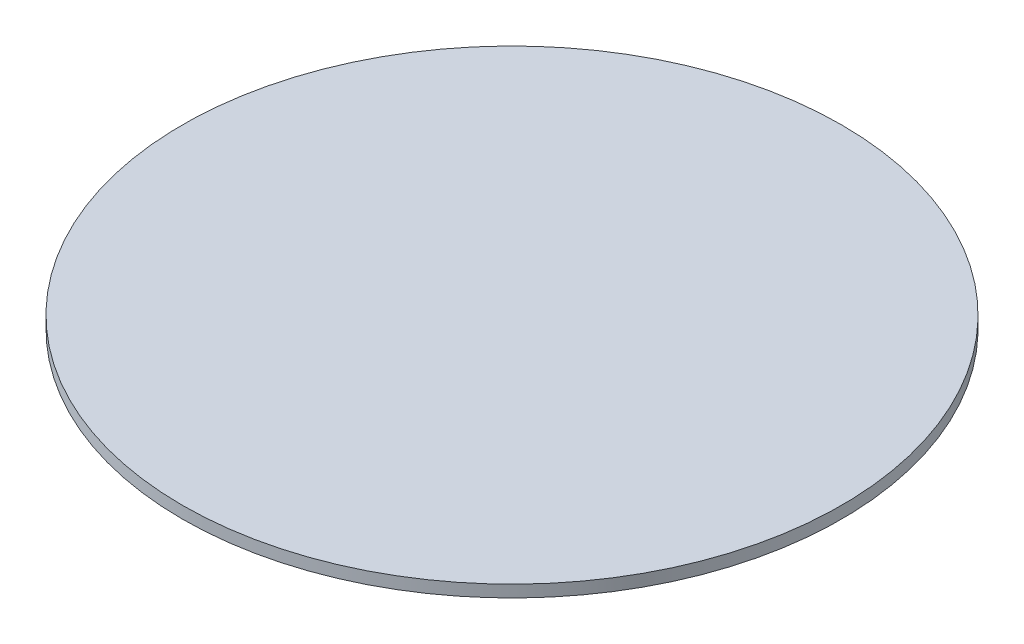
from build123d import *

# Parameters (mm, degrees)
ESBO_O1_R                = 110
RESSALTO_EXTRUS_O1_DEPTH = 4


with BuildPart() as part:
    # Esboço1 → Ressalto-extrusão1 (new body)
    with BuildSketch(Plane(origin=(0, 0, 0), x_dir=(1, 0, 0), z_dir=(0, 1, 0))):
        Circle(ESBO_O1_R)
    extrude(amount=RESSALTO_EXTRUS_O1_DEPTH)


solid = part.part
